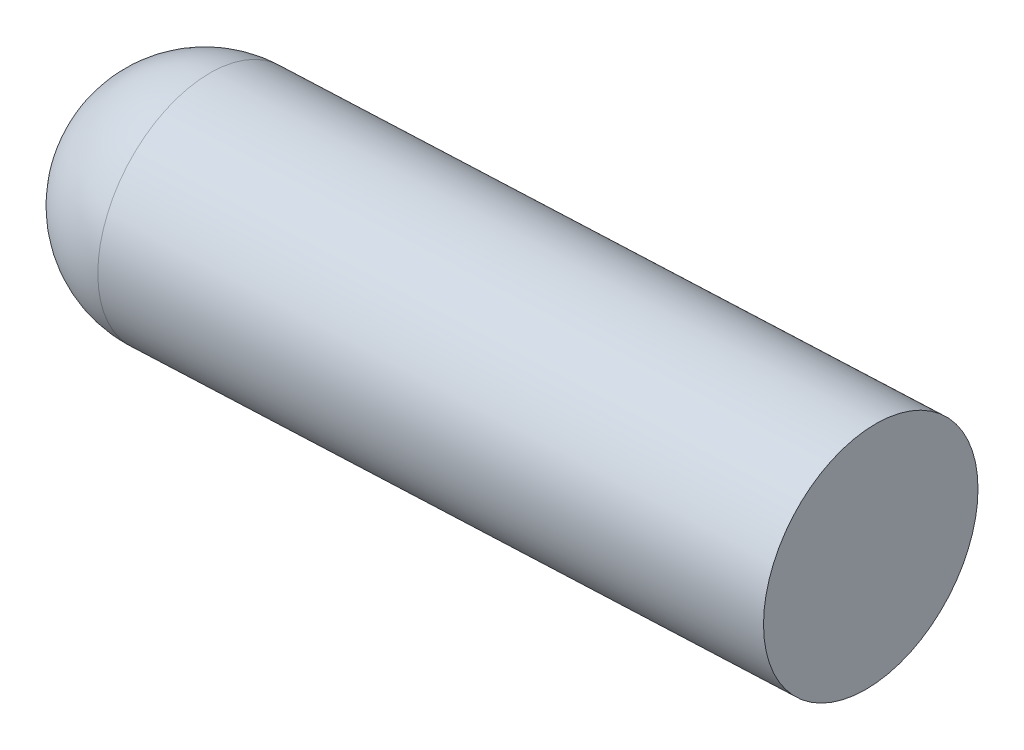
from build123d import *

# Parameters (mm, degrees)
SKETCH1_R           = 15
BOSS_EXTRUDE1_DEPTH = 100
FILLET1_R           = 15
SKALA1_SCALE        = 0.9168


# Read off the part's stored shape, not the designer's step: Bill Native-28-surface1
with BuildPart() as part:
    # Sketch1 → Boss-Extrude1 (new body)
    with BuildSketch(Plane(origin=(87.322284579, 0, -3.975399354), x_dir=(0.04547849496662145, 0, 0.9989653179643281), z_dir=(-0.9989653179643281, 0, 0.04547849496662145))):
        with Locations((-66.108493759, -228.751608372)):
            Circle(SKETCH1_R)
    extrude(amount=BOSS_EXTRUDE1_DEPTH)

    # Fillet1
    fillet1_edges = [part.edges().sort_by_distance(p)[0] for p in [
        (-16.262939442, -228.751608372, -80.452122115),
    ]]
    fillet(fillet1_edges, radius=FILLET1_R)


with BuildPart() as part_1:
    # Skala1: scaled about (36.799195773, -228.751608372, -67.852271325)
    add(part.part.scale(SKALA1_SCALE).moved(Location((3.061693088, -19.032133817, -5.645308974))))


solid = part_1.part
